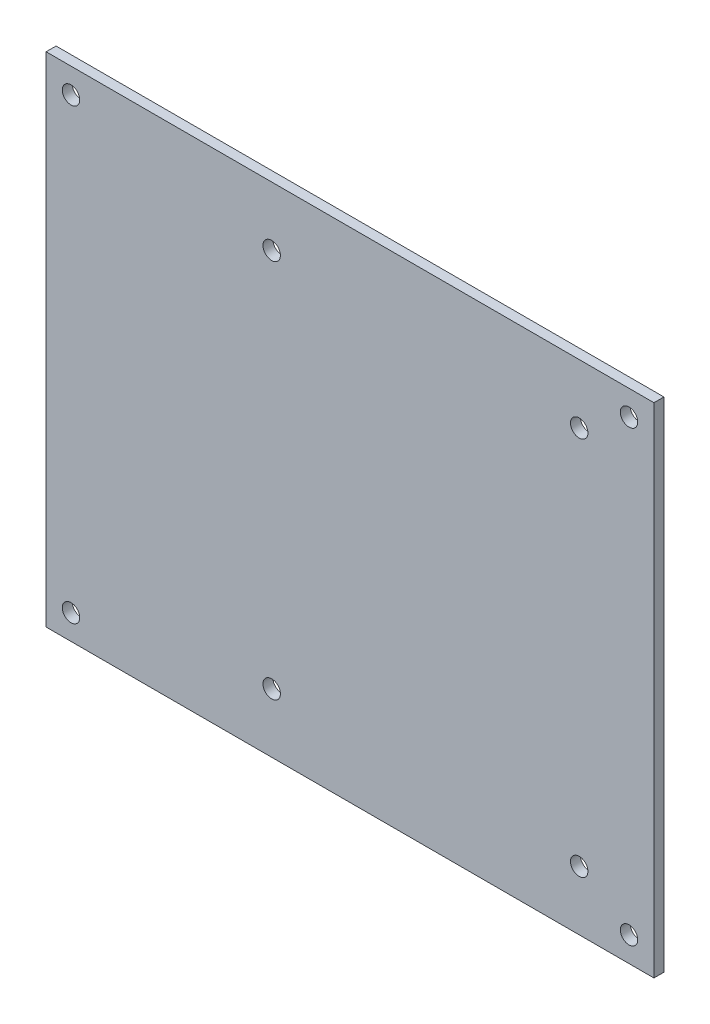
from build123d import *

# Parameters (mm, degrees)
SKETCH1_W           = 100
SKETCH1_H           = 122
SKETCH1_R           = 1.75
BOSS_EXTRUDE1_DEPTH = 2


with BuildPart() as part:
    # Sketch1 → Boss-Extrude1 (new body)
    with BuildSketch(Plane(origin=(0, 0, 0), x_dir=(0, 1, 0), z_dir=(0, 0, 1))):
        Rectangle(SKETCH1_W, SKETCH1_H)
        with Locations((-45, 56)):
            Circle(SKETCH1_R, mode=Mode.SUBTRACT)
        with Locations((45, 56)):
            Circle(SKETCH1_R, mode=Mode.SUBTRACT)
        with Locations((-45, -56)):
            Circle(SKETCH1_R, mode=Mode.SUBTRACT)
        with Locations((45, -56)):
            Circle(SKETCH1_R, mode=Mode.SUBTRACT)
        with Locations((-38.1, -46)):
            Circle(SKETCH1_R, mode=Mode.SUBTRACT)
        with Locations((38.1, -46)):
            Circle(SKETCH1_R, mode=Mode.SUBTRACT)
        with Locations((-38.1, 15.72)):
            Circle(SKETCH1_R, mode=Mode.SUBTRACT)
        with Locations((38.1, 15.72)):
            Circle(SKETCH1_R, mode=Mode.SUBTRACT)
    extrude(amount=BOSS_EXTRUDE1_DEPTH)


solid = part.part
